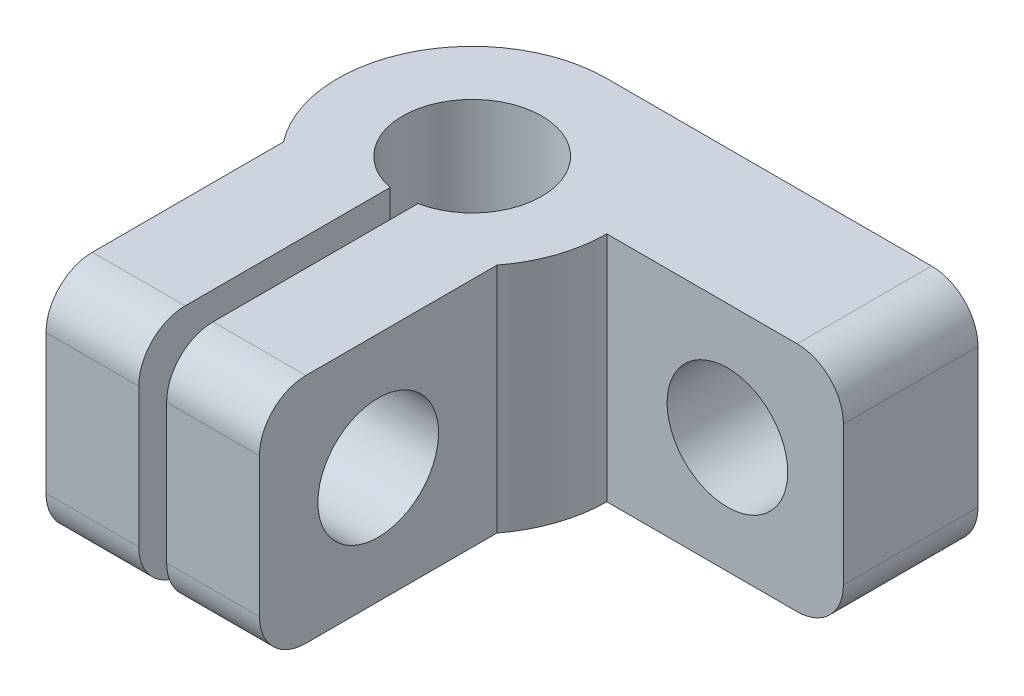
from build123d import *

# Parameters (mm, degrees)
BOSS_EXTRUDE1_DEPTH = 5
SKETCH2_R           = 1.3
CUT_EXTRUDE1_DEPTH  = 14.35984761
SKETCH3_R           = 1.3
CUT_EXTRUDE2_DEPTH  = 14.591735948
FILLET1_R           = 1
FILLET2_R           = 1


with BuildPart() as part:
    # Sketch1 → Boss-Extrude1 (new body)
    with BuildSketch(Plane(origin=(0, 0, 0), x_dir=(1, 0, 0), z_dir=(0, 1, 0))):
        with BuildLine():
            Line((8, 2.9), (0, 2.9))
            ThreePointArc((0, 2.9), (-2.601194082, 1.282103486), (-2.3, -1.766352173))
            Line((-2.3, -1.766352173), (-2.3, -6.88444102))
            Line((-2.3, -6.88444102), (-0.3, -6.88444102))
            Line((-0.3, -6.88444102), (-0.3, -2.88444102))
            Line((-0.3, -2.88444102), (-0.3, -1.469693846))
            ThreePointArc((-0.3, -1.469693846), (0, 1.5), (0.3, -1.469693846))
            Line((0.3, -1.469693846), (0.3, -2.88444102))
            Line((0.3, -2.88444102), (0.3, -6.88444102))
            Line((0.3, -6.88444102), (2.3, -6.88444102))
            Line((2.3, -6.88444102), (2.3, -1.766352173))
            ThreePointArc((2.3, -1.766352173), (2.745906044, -0.932737905), (2.9, 0))
            Line((2.9, 0), (8, 0))
            Line((8, 0), (8, 2.9))
        make_face()
    extrude(amount=BOSS_EXTRUDE1_DEPTH)

    # Sketch2 → Cut-Extrude1 (cut, through all)
    with BuildSketch(Plane.ZY.offset(2.3)):
        with Locations((4.325396597, 2.5)):
            Circle(SKETCH2_R)
    extrude(amount=-CUT_EXTRUDE1_DEPTH, mode=Mode.SUBTRACT)

    # Sketch3 → Cut-Extrude2 (cut, through all)
    with BuildSketch(Plane(origin=(0, 0, -2.9), x_dir=(-1, 0, 0), z_dir=(0, 0, -1))):
        with Locations((-5.5, 2.5)):
            Circle(SKETCH3_R)
    extrude(amount=-CUT_EXTRUDE2_DEPTH, mode=Mode.SUBTRACT)

    # Fillet1
    fillet1_edges = [part.edges().sort_by_distance(p)[0] for p in [
        (-1.3, 5, 6.88444102),
        (-1.3, 0, 6.88444102),
        (1.3, 0, 6.88444102),
        (1.3, 5, 6.88444102),
    ]]
    fillet(fillet1_edges, radius=FILLET1_R)

    # Fillet2
    fillet2_edges = [part.edges().sort_by_distance(p)[0] for p in [
        (8, 0, -1.45),
        (8, 5, -1.45),
    ]]
    fillet(fillet2_edges, radius=FILLET2_R)


solid = part.part
